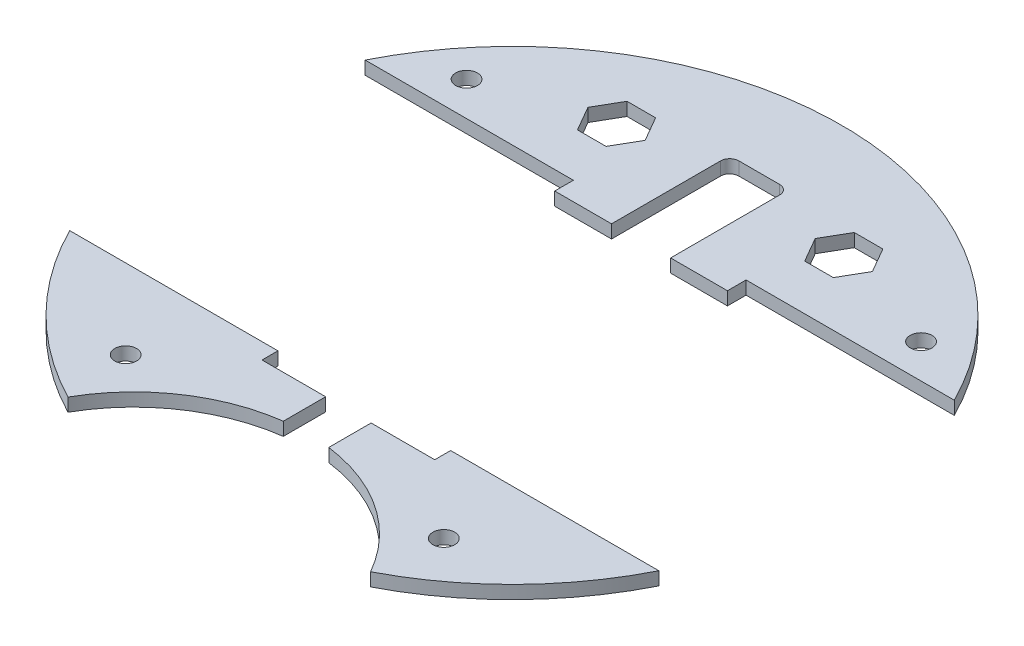
from build123d import *

# Parameters (mm, degrees)
BOSS_EXTRUDE1_DEPTH  = 2.9
SOLENOID_PLACEMENT_W = 38
SOLENOID_PLACEMENT_H = 64.4
CUT_EXTRUDE1_DEPTH   = 103.571487266
CUT_EXTRUDE4_DEPTH   = 103.571487266
CUT_EXTRUDE5_DEPTH   = 103.571487266
SKETCH6_R            = 2.4
CUT_EXTRUDE6_DEPTH   = 103.571487266
CUT_EXTRUDE3_DEPTH   = 103.571487266
SKETCH7_W            = 10
SKETCH7_H            = 62.80248699
CUT_EXTRUDE7_DEPTH   = 98.286484159


with BuildPart() as part:
    # Sketch1 → Boss-Extrude1 (new body)
    with BuildSketch(Plane(origin=(0, 0, 0), x_dir=(1, 0, 0), z_dir=(0, 1, 0))):
        with BuildLine():
            ThreePointArc((33.29110537, -64.404598464), (0, 72.5), (-33.29110537, -64.404598464))
            ThreePointArc((-33.29110537, -64.404598464), (0, -44.989799638), (33.29110537, -64.404598464))
        make_face()
    extrude(amount=BOSS_EXTRUDE1_DEPTH)

    # solenoid placement → Cut-Extrude1 (cut, through all)
    with BuildSketch(Plane(origin=(0, 2.9, 0), x_dir=(1, 0, 0), z_dir=(0, 1, 0))):
        with Locations((0, -3.8)):
            Rectangle(SOLENOID_PLACEMENT_W, SOLENOID_PLACEMENT_H)
    extrude(amount=-CUT_EXTRUDE1_DEPTH, mode=Mode.SUBTRACT)

    # Sketch4 → Cut-Extrude4 (cut, through all)
    with BuildSketch(Plane(origin=(0, 2.9, 0), x_dir=(1, 0, 0), z_dir=(0, 1, 0))):
        with BuildLine():
            Line((-6.5, 28.1), (6.5, 28.1))
            Line((6.5, 28.1), (6.5, 52.4))
            ThreePointArc((6.5, 52.4), (5.914213562, 53.814213562), (4.5, 54.4))
            Line((4.5, 54.4), (-4.5, 54.4))
            ThreePointArc((-4.5, 54.4), (-5.914213562, 53.814213562), (-6.5, 52.4))
            Line((-6.5, 52.4), (-6.5, 28.1))
        make_face()
    extrude(amount=-CUT_EXTRUDE4_DEPTH, mode=Mode.SUBTRACT)

    # Sketch5 → Cut-Extrude5 (cut, through all)
    with BuildSketch(Plane(origin=(0, 2.9, 0), x_dir=(1, 0, 0), z_dir=(0, 1, 0))):
        Polygon((-18.706882066, 48), (-21.853441033, 53.45), (-28.146558967, 53.45), (-31.293117934, 48), (-28.146558967, 42.55), (-21.853441033, 42.55), align=None)
        Polygon((18.706882066, 48), (21.853441033, 42.55), (28.146558967, 42.55), (31.293117934, 48), (28.146558967, 53.45), (21.853441033, 53.45), align=None)
    extrude(amount=-CUT_EXTRUDE5_DEPTH, mode=Mode.SUBTRACT)

    # Sketch6 → Cut-Extrude6 (cut, through all)
    with BuildSketch(Plane(origin=(0, 2.9, 0), x_dir=(1, 0, 0), z_dir=(0, 1, 0))):
        with Locations((35, -50)):
            Circle(SKETCH6_R)
        with Locations((-35, -50)):
            Circle(SKETCH6_R)
        with Locations((-50, 40)):
            Circle(SKETCH6_R)
        with Locations((50, 40)):
            Circle(SKETCH6_R)
    extrude(amount=-CUT_EXTRUDE6_DEPTH, mode=Mode.SUBTRACT)

    # Sketch3 → Cut-Extrude3 (cut, through all)
    with BuildSketch(Plane(origin=(0, 2.9, 0), x_dir=(1, 0, 0), z_dir=(0, 1, 0))):
        Polygon((-19, 28.4), (-19, 32.5), (-72.5, 32.5), (-72.5, -32.5), (72.5, -32.5), (72.5, 32.5), (19, 32.5), (19, 28.4), align=None)
    extrude(amount=-CUT_EXTRUDE3_DEPTH, mode=Mode.SUBTRACT)


with BuildPart() as cut_extrude3_piece_1:
    # of the separate pieces the step leaves, piece 1, a body of its own (cut_extrude3_pieces)
    add(part.part.solids().sort_by_distance((64.807406984, 0, -32.5))[0])


with BuildPart() as cut_extrude3_piece_2:
    # of the separate pieces the step leaves, piece 2, a body of its own (cut_extrude3_pieces)
    add(part.part.solids().sort_by_distance((-33.29110537, 0, 64.404598464))[0])

    # Sketch7 → Cut-Extrude7 (cut, through all)
    with BuildSketch(Plane(origin=(0, 2.9, 0), x_dir=(1, 0, 0), z_dir=(0, 1, 0))):
        with Locations((0, -31.401243495)):
            Rectangle(SKETCH7_W, SKETCH7_H)
    extrude(amount=-CUT_EXTRUDE7_DEPTH, mode=Mode.SUBTRACT)


with BuildPart() as cut_extrude7_piece_1:
    # of the separate pieces the step leaves, piece 1, a body of its own (cut_extrude7_pieces)
    add(cut_extrude3_piece_2.part.solids().sort_by_distance((-33.29110537, 0, 64.404598464))[0])


with BuildPart() as cut_extrude7_piece_2:
    # of the separate pieces the step leaves, piece 2, a body of its own (cut_extrude7_pieces)
    add(cut_extrude3_piece_2.part.solids().sort_by_distance((5, 0, 45.318005113))[0])


solid = Compound([cut_extrude3_piece_1.part, cut_extrude7_piece_1.part, cut_extrude7_piece_2.part])
